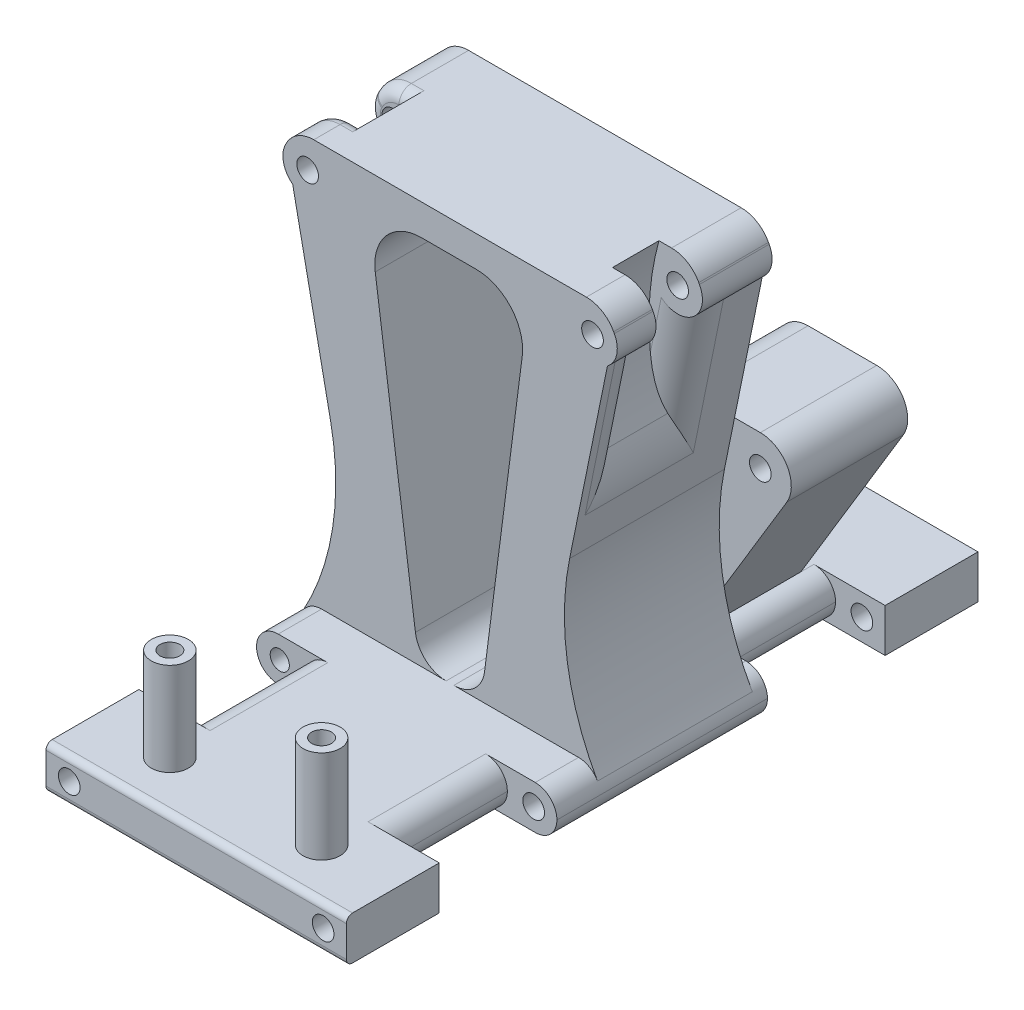
from build123d import *

# Parameters (mm, degrees)
SKETCH3_W               = 48.5
SKETCH3_H               = 15
BOSS_EXTRUDE1_DEPTH     = 7
SKETCH4_R               = 1.75
CUT_EXTRUDE1_DEPTH      = 73.533182062
FILLET1_R               = 3.5
FILLET2_R               = 1
BOSS_EXTRUDE2_START     = -15.1
SKETCH5_R               = 5
SKETCH5_R_2             = 1.75
BOSS_EXTRUDE2_DEPTH     = 18.8
BOSS_EXTRUDE2_2_DEPTH   = 18.8
BOSS_EXTRUDE3_START     = -18.8
BOSS_EXTRUDE3_OUTLINE_R = 1.75
BOSS_EXTRUDE3_DEPTH     = 18.8
BOSS_EXTRUDE4_START     = 10
SKETCH5_3_R             = 1.75
BOSS_EXTRUDE4_DEPTH     = 25
BOSS_EXTRUDE5_START     = 10
SKETCH5_4_R             = 5
SKETCH5_4_R_2           = 1.75
SKETCH5_4_R_3           = 4
BOSS_EXTRUDE5_DEPTH     = 6.25
BOSS_EXTRUDE6_START     = -3.75
SKETCH5_5_R             = 5
SKETCH5_5_R_2           = 1.75
SKETCH5_5_R_3           = 4
BOSS_EXTRUDE6_DEPTH     = 11.25
SKETCH5_7_R             = 4
CUT_EXTRUDE2_DEPTH      = 3.75
FILLET6_R               = 5
FILLET7_R               = 15
FILLET9_START           = -15
FILLET9_DEPTH           = 25
FILLET13_START          = -15
FILLET13_DEPTH          = 25
FILLET21_R              = 5
FILLET22_R              = 15
FILLET23_R              = 5
CUT_EXTRUDE3_DEPTH      = 50
SKETCH5_10_R            = 1.75
CUT_EXTRUDE4_DEPTH      = 50
FILLET18_R              = 5
SKETCH13_R              = 2.55
SKETCH13_R_2            = 1.55
EXTRUDE_THIN1_DEPTH     = 34
FILLET19_R              = 2
SKETCH14_R              = 3
SKETCH14_R_2            = 1.6
BOSS_EXTRUDE7_DEPTH     = 15


with BuildPart() as part:
    # Sketch3 → Boss-Extrude1 (new body)
    with BuildSketch(Plane(origin=(0, 0, 0), x_dir=(1, 0, 0), z_dir=(0, 1, 0))):
        Polygon((-16.25, -40), (16.25, -40), (16.25, -17), (24.25, -17), (24.25, 17), (16.25, 17), (16.25, 40), (-16.25, 40), (-16.25, 17), (-24.25, 17), (-24.25, -17), (-16.25, -17), align=None)
        with Locations((0, 43.5)):
            Rectangle(SKETCH3_W, SKETCH3_H)
        with Locations((0, -43.5)):
            Rectangle(SKETCH3_W, SKETCH3_H)
    extrude(amount=BOSS_EXTRUDE1_DEPTH)

    # Sketch4 → Cut-Extrude1 (cut, symmetric)
    with BuildSketch(Plane.XY.offset(17)):
        with Locations((-20.5, 3.5)):
            Circle(SKETCH4_R)
    cut_extrude1 = extrude(amount=CUT_EXTRUDE1_DEPTH, both=True, mode=Mode.SUBTRACT)

    # Mirror1: Cut-Extrude1 across plane
    add(cut_extrude1.mirror(Plane(origin=(0, 0, 0), x_dir=(0, 0, 1), z_dir=(1, 0, 0))), mode=Mode.SUBTRACT)

    # Fillet1
    fillet1_edges = [part.edges().sort_by_distance(p)[0] for p in [
        (-24.25, 0, 0),
        (-24.25, 7, 0),
        (24.25, 0, 0),
        (24.25, 7, 0),
        (16.25, 0, 26.5),
        (16.25, 7, 26.5),
        (16.25, 0, -26.5),
        (16.25, 7, -26.5),
        (-16.25, 0, -26.5),
        (-16.25, 7, -26.5),
        (-16.25, 0, 26.5),
        (-16.25, 7, 26.5),
    ]]
    fillet(fillet1_edges, radius=FILLET1_R - 0.0001)  # a hair under: the kernel refuses the full size

    # Fillet2
    fillet2_edges = [part.edges().sort_by_distance(p)[0] for p in [
        (0, 7, 51),
        (0, 0, 51),
    ]]
    fillet(fillet2_edges, radius=FILLET2_R)



with BuildPart() as body_2:
    # Sketch5 → Boss-Extrude2 (new body)
    with BuildSketch(Plane.XY.offset(BOSS_EXTRUDE2_START)):
        with Locations((25, 37)):
            Circle(SKETCH5_R)
        with Locations((25, 37)):
            Circle(SKETCH5_R_2, mode=Mode.SUBTRACT)
    extrude(amount=-BOSS_EXTRUDE2_DEPTH)


with BuildPart() as body_3:
    # Sketch5 → Boss-Extrude2 2 (new body)
    with BuildSketch(Plane.XY.offset(BOSS_EXTRUDE2_START)):
        with Locations((-25, 37)):
            Circle(SKETCH5_R)
        with Locations((-25, 37)):
            Circle(SKETCH5_R_2, mode=Mode.SUBTRACT)
    extrude(amount=-BOSS_EXTRUDE2_2_DEPTH)


with BuildPart() as part_1:
    add(part.part)

    add(body_2.part)  # Boss-Extrude3 merges body 2

    add(body_3.part)  # Boss-Extrude3 merges body 3
    # Boss-Extrude3: read off the stored shape, not the designer's step
    # Boss-Extrude3 outline → Boss-Extrude3 (add)
    with BuildSketch(Plane.XY.offset(-15.1).offset(BOSS_EXTRUDE3_START)):
        with BuildLine():
            ThreePointArc((-25, 42), (-20.646332903, 34.541223311), (-29.281878068, 34.418233122))
            Line((-29.281878068, 34.418233122), (-12.75, 7))
            Line((-12.75, 7), (12.75, 7))
            Line((12.75, 7), (29.281878068, 34.418233122))
            ThreePointArc((29.281878068, 34.418233122), (20.646332903, 34.541223311), (25, 42))
            Line((25, 42), (-25, 42))
        make_face()
        with Locations((-25, 37)):
            Circle(BOSS_EXTRUDE3_OUTLINE_R)
        with Locations((25, 37)):
            Circle(BOSS_EXTRUDE3_OUTLINE_R)
    extrude(amount=BOSS_EXTRUDE3_DEPTH)

    # Sketch5<3> → Boss-Extrude4 (add)
    with BuildSketch(Plane.XY.offset(BOSS_EXTRUDE4_START)):
        with BuildLine():
            ThreePointArc((25.411609271, 64.073651011), (26.907249755, 66.408523681), (26.52531733, 69.154921043))
            Line((26.52531733, 69.154921043), (25, 72))
            Line((25, 72), (-25, 72))
            Line((-25, 72), (-26.52531733, 69.154921043))
            ThreePointArc((-26.52531733, 69.154921043), (-26.907249755, 66.408523681), (-25.411609271, 64.073651011))
            Line((-25.411609271, 64.073651011), (-13.787049438, 7))
            Line((-13.787049438, 7), (13.787049438, 7))
            Line((13.787049438, 7), (25.411609271, 64.073651011))
        make_face()
        with Locations((23, 67.264911064)):
            Circle(SKETCH5_3_R, mode=Mode.SUBTRACT)
        with Locations((-23, 67.264911064)):
            Circle(SKETCH5_3_R, mode=Mode.SUBTRACT)
    extrude(amount=-BOSS_EXTRUDE4_DEPTH)

    # Sketch5<4> → Boss-Extrude5 (add)
    # profile 1 of 4: a face of its own
    with BuildSketch(Plane.XY.offset(BOSS_EXTRUDE5_START)):
        with Locations((-25, 37)):
            Circle(SKETCH5_4_R)
        with Locations((-25, 37)):
            Circle(SKETCH5_4_R_2, mode=Mode.SUBTRACT)
    # profile 2 of 4: a face of its own
    with BuildSketch(Plane.XY.offset(BOSS_EXTRUDE5_START)):
        with Locations((25, 37)):
            Circle(SKETCH5_4_R)
        with Locations((25, 37)):
            Circle(SKETCH5_4_R_2, mode=Mode.SUBTRACT)
    # profile 3 of 4: a face of its own
    with BuildSketch(Plane.XY.offset(BOSS_EXTRUDE5_START)):
        with Locations((-23, 67.264911064)):
            Circle(SKETCH5_4_R_3)
        with Locations((-23, 67.264911064)):
            Circle(SKETCH5_4_R_2, mode=Mode.SUBTRACT)
    # profile 4 of 4: a face of its own
    with BuildSketch(Plane.XY.offset(BOSS_EXTRUDE5_START)):
        with Locations((23, 67.264911064)):
            Circle(SKETCH5_4_R_3)
        with Locations((23, 67.264911064)):
            Circle(SKETCH5_4_R_2, mode=Mode.SUBTRACT)
    extrude(amount=-BOSS_EXTRUDE5_DEPTH)


with BuildPart() as boss_extrude5_kept_piece:
    # of the separate pieces the step leaves, the one the design keeps (boss_extrude5_pieces_kept)
    add(part_1.part.solids().sort_by_distance((-25, 42, -15.1))[0])

    # Sketch5<5> → Boss-Extrude6 (add)
    # profile 1 of 4: a face of its own
    with BuildSketch(Plane.XY.offset(BOSS_EXTRUDE6_START)):
        with Locations((-25, 37)):
            Circle(SKETCH5_5_R)
        with Locations((-25, 37)):
            Circle(SKETCH5_5_R_2, mode=Mode.SUBTRACT)
    # profile 2 of 4: a face of its own
    with BuildSketch(Plane.XY.offset(BOSS_EXTRUDE6_START)):
        with Locations((25, 37)):
            Circle(SKETCH5_5_R)
        with Locations((25, 37)):
            Circle(SKETCH5_5_R_2, mode=Mode.SUBTRACT)
    # profile 3 of 4: a face of its own
    with BuildSketch(Plane.XY.offset(BOSS_EXTRUDE6_START)):
        with Locations((-23, 67.264911064)):
            Circle(SKETCH5_5_R_3)
        with Locations((-23, 67.264911064)):
            Circle(SKETCH5_5_R_2, mode=Mode.SUBTRACT)
    # profile 4 of 4: a face of its own
    with BuildSketch(Plane.XY.offset(BOSS_EXTRUDE6_START)):
        with Locations((23, 67.264911064)):
            Circle(SKETCH5_5_R_3)
        with Locations((23, 67.264911064)):
            Circle(SKETCH5_5_R_2, mode=Mode.SUBTRACT)
    extrude(amount=-BOSS_EXTRUDE6_DEPTH)


with BuildPart() as boss_extrude6_kept_piece:
    # of the separate pieces the step leaves, the one the design keeps (boss_extrude6_pieces_kept)
    add(boss_extrude5_kept_piece.part.solids().sort_by_distance((-25, 42, -15.1))[0])

    # Sketch5<7> → Cut-Extrude2 (cut, symmetric)
    with BuildSketch(Plane.XY):
        with BuildLine():
            ThreePointArc((-19.062112653, 67.967081443), (-19.472078598, 69.994090417), (-19.975232851, 72))
            Line((-19.975232851, 72), (-25, 72))
            Line((-25, 72), (-26.52531733, 69.154921043))
            ThreePointArc((-26.52531733, 69.154921043), (-26.428657173, 69.325083385), (-26.323790008, 69.490314395))
            ThreePointArc((-26.323790008, 69.490314395), (-24.264911064, 71.059644256), (-21.676209992, 71.039507733))
            ThreePointArc((-21.676209992, 71.039507733), (-19.953483469, 69.856963731), (-19.062112653, 67.967081443))
        make_face()
        with BuildLine():
            ThreePointArc((-21.338079848, 44.073651011), (-18.568748347, 55.864972286), (-19.062112653, 67.967081443))
            ThreePointArc((-19.062112653, 67.967081443), (-19.015558421, 67.617367169), (-19, 67.264911064))
            ThreePointArc((-19, 67.264911064), (-21.217647213, 63.68395888), (-25.411609271, 64.073651011))
            Line((-25.411609271, 64.073651011), (-21.338079848, 44.073651011))
        make_face()
        with Locations((-23, 67.264911064)):
            Circle(SKETCH5_7_R)
    cut_extrude2 = extrude(amount=CUT_EXTRUDE2_DEPTH, both=True, mode=Mode.SUBTRACT)

    # Fillet6
    fillet6_edges = [boss_extrude6_kept_piece.edges().sort_by_distance(p)[0] for p in [
        (-23.374844559, 54.073651011, 3.75),
        (-23.374844559, 54.073651011, -3.75),
    ]]
    fillet(fillet6_edges, radius=FILLET6_R)

    # Fillet7
    fillet7_edges = [boss_extrude6_kept_piece.edges().sort_by_distance(p)[0] for p in [
        (-21.338079848, 44.073651011, 0),
    ]]
    fillet(fillet7_edges, radius=FILLET7_R)

    # Fillet9: read off the stored shape, not the designer's step
    # Fillet9 outline → Fillet9 (add)
    with BuildSketch(Plane.XY.offset(FILLET9_START)):
        with BuildLine():
            ThreePointArc((20.75, 7), (22.520603595, 6.519099685), (23.804645004, 5.208550233))
            ThreePointArc((23.804645004, 5.208550233), (18.960822085, 19.246922725), (19.305350815, 34.093465173))
            Line((19.305350815, 34.093465173), (13.787049438, 7))
            Line((13.787049438, 7), (20.75, 7))
        make_face()
    extrude(amount=FILLET9_DEPTH)

    # Fillet13: read off the stored shape, not the designer's step
    # Fillet13 outline → Fillet13 (add)
    with BuildSketch(Plane.XY.offset(FILLET13_START)):
        with BuildLine():
            ThreePointArc((-23.804645004, 5.208550233), (-22.520603595, 6.519099685), (-20.75, 7))
            Line((-20.75, 7), (-13.787049438, 7))
            Line((-13.787049438, 7), (-19.305350815, 34.093465173))
            ThreePointArc((-19.305350815, 34.093465173), (-18.960822085, 19.246922725), (-23.804645004, 5.208550233))
        make_face()
    extrude(amount=FILLET13_DEPTH)

    # Mirror3: Cut-Extrude2 across plane
    add(cut_extrude2.mirror(Plane(origin=(0, 0, 0), x_dir=(0, 0, 1), z_dir=(1, 0, 0))), mode=Mode.SUBTRACT)

    # Fillet21
    fillet21_edges = [boss_extrude6_kept_piece.edges().sort_by_distance(p)[0] for p in [
        (23.374844559, 54.073651011, -3.75),
        (23.374844559, 54.073651011, 3.75),
    ]]
    fillet(fillet21_edges, radius=FILLET21_R)

    # Fillet22
    fillet22_edges = [boss_extrude6_kept_piece.edges().sort_by_distance(p)[0] for p in [
        (21.338079848, 44.073651011, 0),
    ]]
    fillet(fillet22_edges, radius=FILLET22_R)

    # Fillet23
    fillet23_edges = [boss_extrude6_kept_piece.edges().sort_by_distance(p)[0] for p in [
        (-25, 72, -9.375),
        (25, 72, -9.375),
        (-25, 72, 6.875),
        (25, 72, 6.875),
    ]]
    fillet(fillet23_edges, radius=FILLET23_R)

    # Sketch12 → Cut-Extrude3 (cut)
    with BuildSketch(Plane.XY.offset(10)):
        with BuildLine():
            Line((-5.594296086, 11.318313999), (-12.084445354, 58.477470998))
            ThreePointArc((-12.084445354, 58.477470998), (-10.307748635, 64.428540985), (-4.654476684, 67))
            Line((-4.654476684, 67), (4.212643004, 67))
            ThreePointArc((4.212643004, 67), (9.845096065, 64.452319913), (11.650965524, 58.540126005))
            Line((11.650965524, 58.540126005), (5.562644499, 11.360084003))
            ThreePointArc((5.562644499, 11.360084003), (3.905309428, 8.245031293), (0.603762819, 7))
            Line((0.603762819, 7), (-0.640983639, 7))
            ThreePointArc((-0.640983639, 7), (-3.92667763, 8.231152032), (-5.594296086, 11.318313999))
        make_face()
    extrude(amount=-CUT_EXTRUDE3_DEPTH, mode=Mode.SUBTRACT)

    # Sketch5<10> → Cut-Extrude4 (cut)
    with BuildSketch(Plane.XY):
        with Locations((25, 37)):
            Circle(SKETCH5_10_R)
        with Locations((-25, 37)):
            Circle(SKETCH5_10_R)
    extrude(amount=-CUT_EXTRUDE4_DEPTH, mode=Mode.SUBTRACT)

    # Fillet18
    fillet18_edges = [boss_extrude6_kept_piece.edges().sort_by_distance(p)[0] for p in [
        (9.516554603, 42, -24.5),
        (-9.81677873, 42, -24.5),
    ]]
    fillet(fillet18_edges, radius=FILLET18_R)

    # Sketch13 → Extrude-Thin1 (add)
    with BuildSketch(Plane.XY.offset(17)):
        with Locations((-20.5, 3.5)):
            Circle(SKETCH13_R)
        with Locations((-20.5, 3.5)):
            Circle(SKETCH13_R_2, mode=Mode.SUBTRACT)
    extrude(amount=-EXTRUDE_THIN1_DEPTH)

    # Fillet19
    fillet19_edges = [boss_extrude6_kept_piece.edges().sort_by_distance(p)[0] for p in [
        (-20.991304304, 72, -3.75),
        (-24.575199508, 71.29025421, -3.75),
        (-26.469669875, 69.258716758, -3.75),
        (-20.991304304, 72, 3.75),
        (-24.575199508, 71.29025421, 3.75),
        (-26.469669875, 69.258716758, 3.75),
        (-25.481431024, 64.127635164, -3.75),
        (-25.481431024, 64.127635164, 3.75),
    ]]
    fillet(fillet19_edges, radius=FILLET19_R)

    # Sketch14 → Boss-Extrude7 (add)
    # profile 1 of 2: a face of its own
    with BuildSketch(Plane(origin=(0, 7, 0), x_dir=(1, 0, 0), z_dir=(0, 1, 0))):
        with Locations(Location((-12.25, -43, 0), (0, 0, 90))):
            Circle(SKETCH14_R)
        with Locations(Location((-12.25, -43, 0), (0, 0, 270))):
            Circle(SKETCH14_R_2, mode=Mode.SUBTRACT)
    # profile 2 of 2: a face of its own
    with BuildSketch(Plane(origin=(0, 7, 0), x_dir=(1, 0, 0), z_dir=(0, 1, 0))):
        with Locations(Location((12.25, -43, 0), (0, 0, 90))):
            Circle(SKETCH14_R)
        with Locations(Location((12.25, -43, 0), (0, 0, 90))):
            Circle(SKETCH14_R_2, mode=Mode.SUBTRACT)
    extrude(amount=BOSS_EXTRUDE7_DEPTH)


solid = boss_extrude6_kept_piece.part
